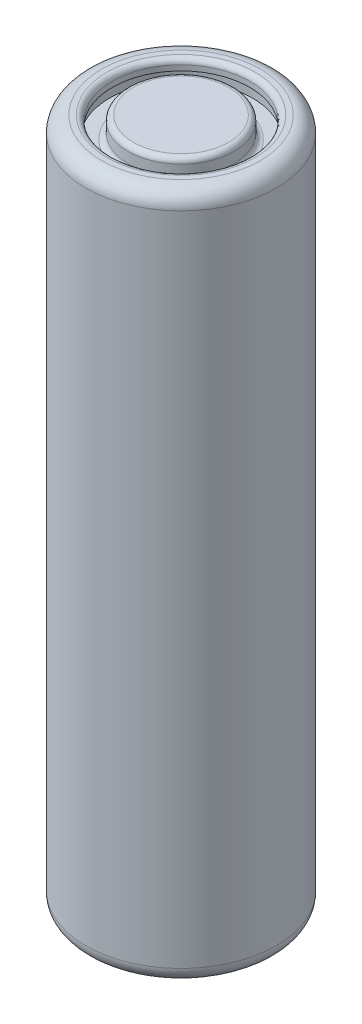
from build123d import *

# Parameters (mm, degrees)
SKETCH_1_R          = 9
EXTRUDE_1_DEPTH     = 65
SKETCH_2_R          = 6.5
SKETCH_2_R_2        = 5
CUT_EXTRUDE_1_DEPTH = 2
SKETCH_3_R          = 7.5
CUT_EXTRUDE_2_DEPTH = 0.25
CUT_EXTRUDE_START   = 1
SKETCH_4_R          = 6.75
SKETCH_4_R_2        = 5
CUT_EXTRUDE_3_DEPTH = 1
FILLET_1_R          = 1.5
FILLET_2_R          = 0.5
FILLET_3_R          = 0.5


with BuildPart() as part:
    # 草图1 → 凸台-拉伸1 (new body)
    with BuildSketch(Plane(origin=(0, 0, 0), x_dir=(1, 0, 0), z_dir=(0, 1, 0))):
        with Locations(Location((0, 0, 0), (0, 0, 270))):
            Circle(SKETCH_1_R)
    extrude(amount=EXTRUDE_1_DEPTH)

    # 草图2 → 切除-拉伸1 (cut)
    with BuildSketch(Plane(origin=(0, 65, 0), x_dir=(1, 0, 0), z_dir=(0, 1, 0))):
        with Locations(Location((0, 0, 0), (0, 0, 270))):
            Circle(SKETCH_2_R)
        with Locations(Location((0, 0, 0), (0, 0, 270))):
            Circle(SKETCH_2_R_2, mode=Mode.SUBTRACT)
    extrude(amount=-CUT_EXTRUDE_1_DEPTH, mode=Mode.SUBTRACT)

    # 草图3 → 切除-拉伸2 (cut)
    with BuildSketch(Plane(origin=(0, 0, 0), x_dir=(-1, 0, 0), z_dir=(0, -1, 0))):
        with Locations(Location((0, 0, 0), (0, 0, 90))):
            Circle(SKETCH_3_R)
    extrude(amount=-CUT_EXTRUDE_2_DEPTH, mode=Mode.SUBTRACT)

    # 草图4 → 切除-拉伸3 (cut)
    with BuildSketch(Plane(origin=(0, 63, 0), x_dir=(1, 0, 0), z_dir=(0, 1, 0)).offset(CUT_EXTRUDE_START)):
        with Locations(Location((0, 0, 0), (0, 0, 270))):
            Circle(SKETCH_4_R)
        with Locations(Location((0, 0, 0), (0, 0, 270))):
            Circle(SKETCH_4_R_2, mode=Mode.SUBTRACT)
    extrude(amount=-CUT_EXTRUDE_3_DEPTH, mode=Mode.SUBTRACT)

    # 圆角1
    fillet_1_edges = [part.edges().sort_by_distance(p)[0] for p in [
        (0, 0, -9),
        (0, 65, -9),
    ]]
    fillet(fillet_1_edges, radius=FILLET_1_R - 0.0001)  # a hair under: the kernel refuses the full size

    # 圆角2
    fillet_2_edges = [part.edges().sort_by_distance(p)[0] for p in [
        (0, 65, -6.5),
    ]]
    fillet(fillet_2_edges, radius=FILLET_2_R)

    # 圆角3
    fillet_3_edges = [part.edges().sort_by_distance(p)[0] for p in [
        (0, 63, -5),
        (0, 65, -5),
    ]]
    fillet(fillet_3_edges, radius=FILLET_3_R)


solid = part.part
